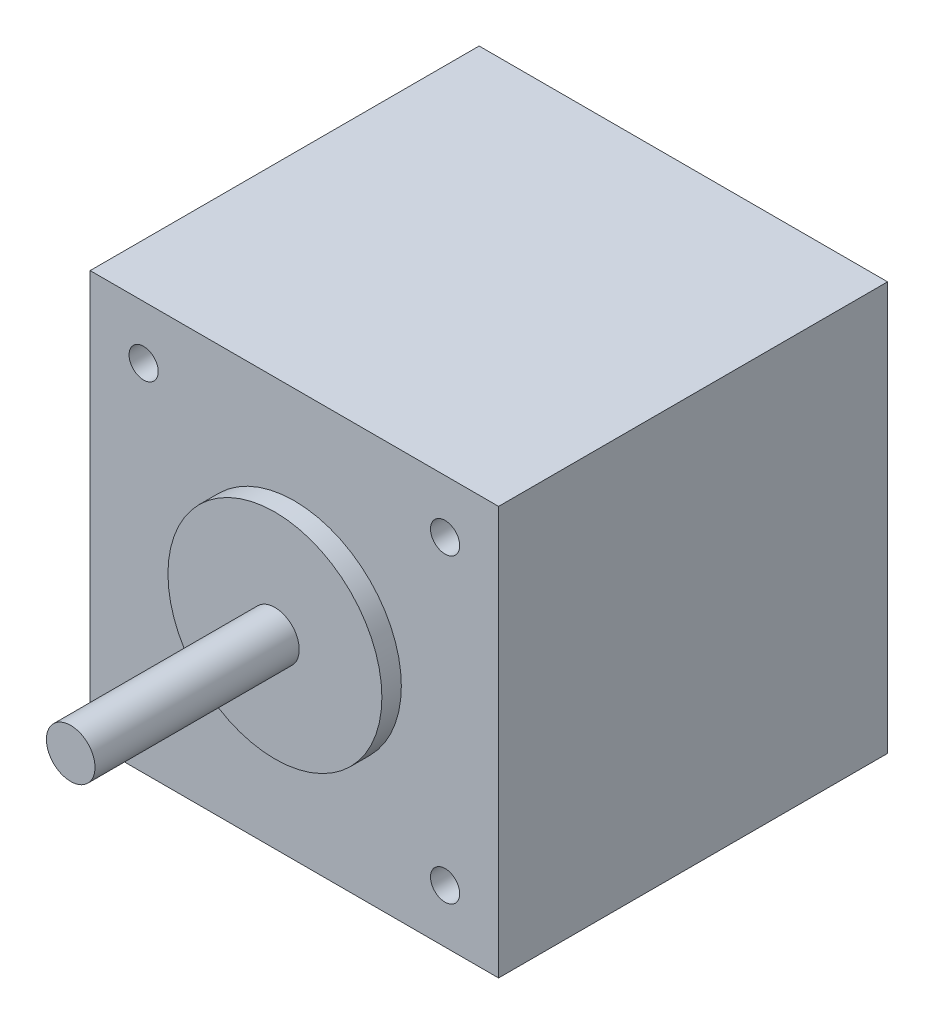
from build123d import *

# Parameters (mm, degrees)
SKETCH_1_W          = 42
SKETCH_1_H          = 42
EXTRUDE_1269_DEPTH  = 40
SKETCH_2_R          = 2.5
EXTRUDE_1324_DEPTH  = 63
SKETCH_3_R          = 11
EXTRUDE_1371_DEPTH  = 42
CUT_EXTRUDE_START   = 40
SKETCH_4_R          = 1.5
CUT_EXTRUDE_3_DEPTH = 4.5


with BuildPart() as part:
    # Эскиз1 → Extrude 1269 (new body)
    with BuildSketch(Plane.XY):
        Rectangle(SKETCH_1_W, SKETCH_1_H)
    extrude(amount=EXTRUDE_1269_DEPTH)

    # Эскиз2 → Extrude 1324 (add)
    with BuildSketch(Plane.XY):
        Circle(SKETCH_2_R)
    extrude(amount=EXTRUDE_1324_DEPTH)

    # Эскиз3 → Extrude 1371 (add)
    with BuildSketch(Plane.XY):
        Circle(SKETCH_3_R)
    extrude(amount=EXTRUDE_1371_DEPTH)

    # Эскиз4 → Крепеж_М3_ПРЕДВ (cut)
    with BuildSketch(Plane.XY.offset(CUT_EXTRUDE_START)):
        with Locations((-15.5, -15.5)):
            Circle(SKETCH_4_R)
        with Locations((-15.5, 15.5)):
            Circle(SKETCH_4_R)
        with Locations((15.5, -15.5)):
            Circle(SKETCH_4_R)
        with Locations((15.5, 15.5)):
            Circle(SKETCH_4_R)
    extrude(amount=-CUT_EXTRUDE_3_DEPTH, mode=Mode.SUBTRACT)


solid = part.part
